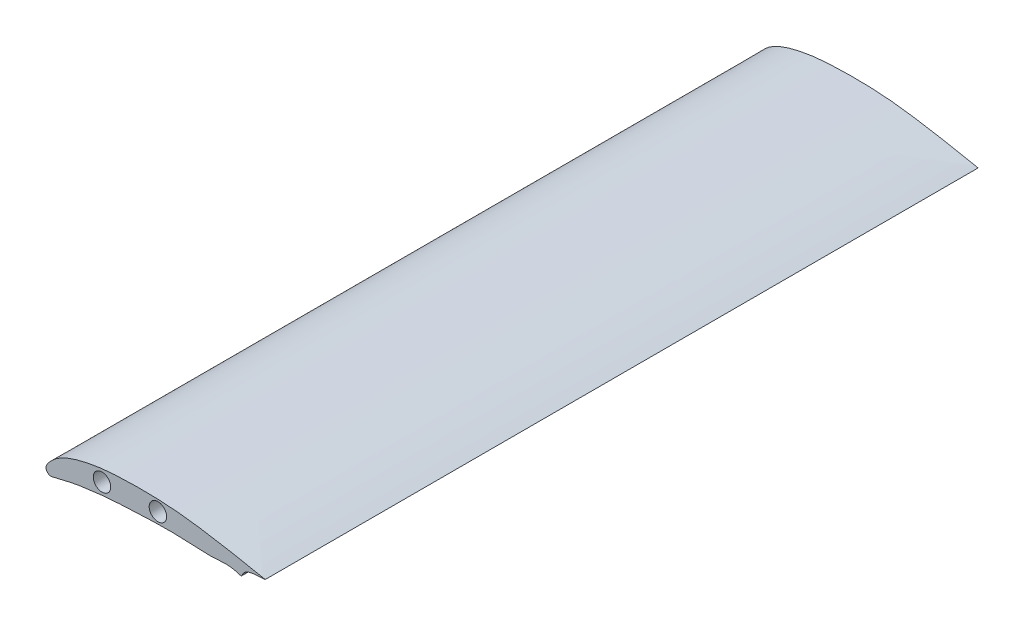
from build123d import *

# Parameters (mm, degrees)
CUT_SKETCH_R        = 7.9375
BOSS_EXTRUDE1_DEPTH = 647.7


with BuildPart() as part:
    # cut sketch → Boss-Extrude1 (new body)
    with BuildSketch(Plane.XY):
        with BuildLine():
            add(Edge.make_bspline(
                [(198.755, 12.4341128), (197.958760534, 12.674892788), (193.016318766, 13.534169148), (188.294054353, 14.518485523), (182.85172621, 15.57923738), (170.951086301, 17.968884392), (152.188580231, 21.269451629), (126.82105562, 25.207670551), (101.321432861, 27.148849085), (75.878614338, 27.174929415), (54.634944714, 26.193996481), (37.720618746, 23.47384193), (27.137769344, 20.862450998), (18.699797435, 17.833624005), (12.223275623, 14.71753923), (6.863222639, 10.853018112), (2.512639265, 6.224815143), (-1.733104496, 0.897280663), (2.557540987, -4.25639396), (7.562017195, -3.186499038), (12.697615423, -1.980232946), (19.047489975, -0.424332295), (27.430473238, 1.485927044), (38.05107458, 2.872009756), (54.921214233, 5.06075421), (76.095993299, 6.251505502), (101.556610571, 7.373175065), (126.711669411, 7.317359933), (152.2220323, 5.028654081), (166.88520938, 7.943500364), (177.478911208, 3.860781859), (178.973218605, 7.146193578), (183.205786264, 13.092663651), (201.125228023, 11.717364261), (198.755, 12.4341128)],
                knots=[0, 0, 0, 0, 0.013065285, 0.026124911, 0.039193983, 0.052259268, 0.114883726, 0.177153765, 0.238898973, 0.300426496, 0.362023645, 0.393128504, 0.424784776, 0.441091662, 0.458148008, 0.477060579, 0.488020838, 0.50604562, 0.517776685, 0.525474169, 0.54122329, 0.556994005, 0.572702866, 0.603759277, 0.634700771, 0.696321728, 0.75785999, 0.819389386, 0.880956139, 0.936472049, 0.942641552, 0.944142165, 0.961107549, 1, 1, 1, 1], degree=3))
        make_face()
        with Locations((50.8, 14.910491821)):
            Circle(CUT_SKETCH_R, mode=Mode.SUBTRACT)
        with Locations((101.6, 16.999323468)):
            Circle(CUT_SKETCH_R, mode=Mode.SUBTRACT)
    extrude(amount=BOSS_EXTRUDE1_DEPTH)


solid = part.part
